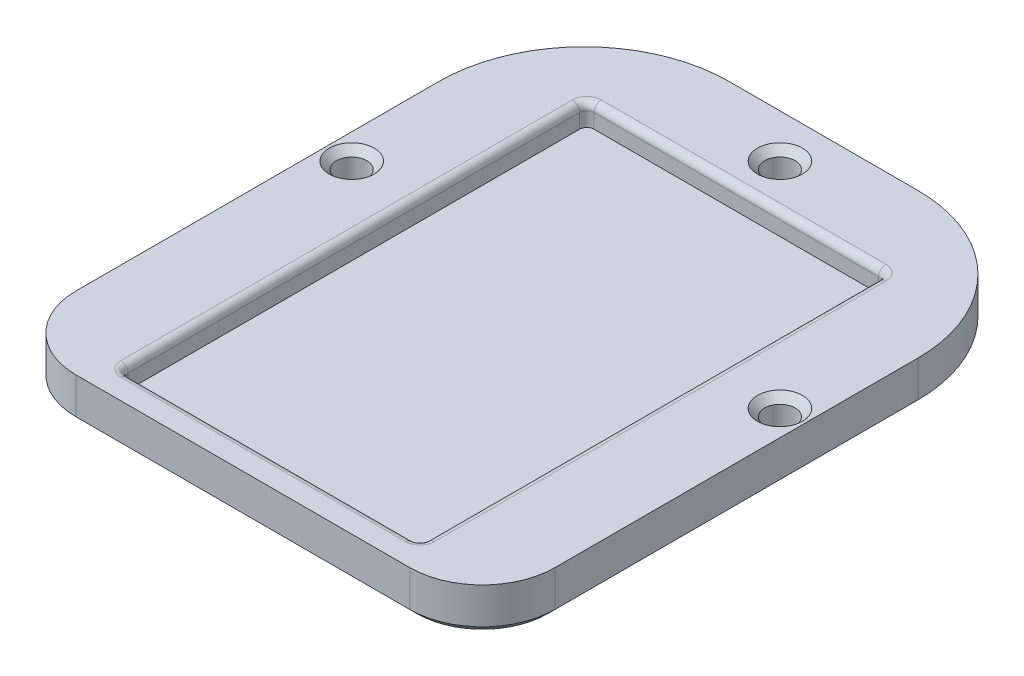
from build123d import *

# Parameters (mm, degrees)
SKETCH_1_W          = 66
SKETCH_1_H          = 80
EXTRUDE_1_DEPTH     = 6
SKETCH_2_W          = 41.2
SKETCH_2_H          = 64.2
CUT_EXTRUDE_1_DEPTH = 3
FILLET_1_R          = 1
SKETCH_3_R          = 2.1
CUT_EXTRUDE_2_DEPTH = 53.201532545
CHAMFER_1_SIZE      = 1
FILLET_2_R          = 20
FILLET_3_R          = 10
CHAMFER_2_SIZE      = 1


with BuildPart() as part:
    # Эскиз1 → Бобышка-Вытянуть1 (new body)
    with BuildSketch(Plane(origin=(0, 0, 0), x_dir=(1, 0, 0), z_dir=(0, 1, 0))):
        Rectangle(SKETCH_1_W, SKETCH_1_H)
    extrude(amount=EXTRUDE_1_DEPTH)

    # Эскиз2 → Вырез-Вытянуть1 (cut)
    with BuildSketch(Plane(origin=(0, 6, 0), x_dir=(1, 0, 0), z_dir=(0, 1, 0))):
        with Locations((0, -4.1)):
            Rectangle(SKETCH_2_W, SKETCH_2_H)
    extrude(amount=-CUT_EXTRUDE_1_DEPTH, mode=Mode.SUBTRACT)

    # Скругление1
    fillet_1_edges = [part.edges().sort_by_distance(p)[0] for p in [
        (20.6, 4.5, -28),
        (20.6, 4.5, 36.2),
        (-20.6, 4.5, 36.2),
        (-20.6, 4.5, -28),
        (20.6, 6, 4.1),
        (0, 6, -28),
        (-20.6, 6, 4.1),
        (0, 6, 36.2),
    ]]
    fillet(fillet_1_edges, radius=FILLET_1_R)

    # Эскиз3 → Вырез-Вытянуть2 (cut, through all)
    with BuildSketch(Plane(origin=(0, 6, 0), x_dir=(1, 0, 0), z_dir=(0, 1, 0))):
        with Locations(Location((0, 34, 0), (0, 0, 270))):
            Circle(SKETCH_3_R)
        with Locations(Location((-29.5, 4.5, 0), (0, 0, 270))):
            Circle(SKETCH_3_R)
        with Locations(Location((29.5, 4.5, 0), (0, 0, 270))):
            Circle(SKETCH_3_R)
    extrude(amount=-CUT_EXTRUDE_2_DEPTH, mode=Mode.SUBTRACT)

    # Фаска1
    chamfer_1_edges = [part.edges().sort_by_distance(p)[0] for p in [
        (0, 6, -36.1),
        (-29.5, 6, -6.6),
        (29.5, 6, -6.6),
    ]]
    chamfer(chamfer_1_edges, length=CHAMFER_1_SIZE)

    # Скругление2
    fillet_2_edges = [part.edges().sort_by_distance(p)[0] for p in [
        (-33, 3, -40),
        (33, 3, -40),
    ]]
    fillet(fillet_2_edges, radius=FILLET_2_R)

    # Скругление3
    fillet_3_edges = [part.edges().sort_by_distance(p)[0] for p in [
        (33, 3, 40),
        (-33, 3, 40),
    ]]
    fillet(fillet_3_edges, radius=FILLET_3_R)

    # Фаска2
    # the kernel refuses this chamfer: 1 mm, written as the material it takes off along each edge
    with BuildSketch(Plane(origin=(-23, 0, 30), x_dir=(-1, 0, 0), z_dir=(0, 0, -1))) as chamfer_2_piece_1:
        Polygon((10, CHAMFER_2_SIZE), (10 - CHAMFER_2_SIZE, 0), (10, 0), align=None)
    revolve(axis=Axis((-23, 0, 30), (0, 1, 0)), revolution_arc=90, mode=Mode.SUBTRACT)
    with BuildSketch(Plane(origin=(0, 0, -34), x_dir=(0, 0, 1), z_dir=(-1, 0, 0))) as chamfer_2_piece_2:
        Polygon((2.1 + CHAMFER_2_SIZE, 0), (2.1, CHAMFER_2_SIZE), (2.1, 0), align=None)
    revolve(axis=Axis((0, 0, -34), (0, 1, 0)), mode=Mode.SUBTRACT)
    with BuildSketch(Plane(origin=(-29.5, 0, -4.5), x_dir=(0, 0, 1), z_dir=(-1, 0, 0))) as chamfer_2_piece_3:
        Polygon((2.1 + CHAMFER_2_SIZE, 0), (2.1, CHAMFER_2_SIZE), (2.1, 0), align=None)
    revolve(axis=Axis((-29.5, 0, -4.5), (0, 1, 0)), mode=Mode.SUBTRACT)
    with BuildSketch(Plane(origin=(29.5, 0, -4.5), x_dir=(0, 0, 1), z_dir=(-1, 0, 0))) as chamfer_2_piece_4:
        Polygon((2.1 + CHAMFER_2_SIZE, 0), (2.1, CHAMFER_2_SIZE), (2.1, 0), align=None)
    revolve(axis=Axis((29.5, 0, -4.5), (0, 1, 0)), mode=Mode.SUBTRACT)
    with BuildSketch(Plane(origin=(-33, 0, -20), x_dir=(-0.02749587661058908, 0.9996219169112968, 0), z_dir=(0, 0, 1)), Plane(origin=(33, 0, 30), x_dir=(0.02749587661058908, 0.9996219169112968, 0), z_dir=(0, 0, -1))) as chamfer_2_piece_5:
        Polygon((CHAMFER_2_SIZE * 0.999621916911, -CHAMFER_2_SIZE * 0.0274958766106), (-CHAMFER_2_SIZE * 0.0274958766106, -CHAMFER_2_SIZE * 0.999621916911), (0, 0), align=None)
    extrude(amount=50, mode=Mode.SUBTRACT)
    with BuildSketch(Plane(origin=(13, 0, -40), x_dir=(0, 0.9996219169112968, -0.02749587661058908), z_dir=(-1, 0, 0))) as chamfer_2_piece_6:
        Polygon((CHAMFER_2_SIZE * 0.999621916911, -CHAMFER_2_SIZE * 0.0274958766106), (-CHAMFER_2_SIZE * 0.0274958766106, -CHAMFER_2_SIZE * 0.999621916911), (0, 0), align=None)
    extrude(amount=26, mode=Mode.SUBTRACT)
    with BuildSketch(Plane(origin=(13, 0, -20), x_dir=(1, 0, 0), z_dir=(0, 0, 1))) as chamfer_2_piece_7:
        Polygon((20, CHAMFER_2_SIZE), (20 - CHAMFER_2_SIZE, 0), (20, 0), align=None)
    revolve(axis=Axis((13, 0, -20), (0, 1, 0)), revolution_arc=90, mode=Mode.SUBTRACT)
    with BuildSketch(Plane(origin=(-13, 0, -20), x_dir=(-1, 0, 0), z_dir=(0, 0, 1))) as chamfer_2_piece_8:
        Polygon((20, -CHAMFER_2_SIZE), (20 - CHAMFER_2_SIZE, 0), (20, 0), align=None)
    revolve(axis=Axis((-13, 0, -20), (0, -1, 0)), revolution_arc=90, mode=Mode.SUBTRACT)
    with BuildSketch(Plane(origin=(-23, 0, 40), x_dir=(0, 0.9996219169112968, 0.02749587661058908), z_dir=(1, 0, 0))) as chamfer_2_piece_9:
        Polygon((CHAMFER_2_SIZE * 0.999621916911, -CHAMFER_2_SIZE * 0.0274958766106), (-CHAMFER_2_SIZE * 0.0274958766106, -CHAMFER_2_SIZE * 0.999621916911), (0, 0), align=None)
    extrude(amount=46, mode=Mode.SUBTRACT)
    with BuildSketch(Plane(origin=(23, 0, 30), x_dir=(0, 0, 1), z_dir=(-1, 0, 0))) as chamfer_2_piece_10:
        Polygon((10, CHAMFER_2_SIZE), (10 - CHAMFER_2_SIZE, 0), (10, 0), align=None)
    revolve(axis=Axis((23, 0, 30), (0, 1, 0)), revolution_arc=90, mode=Mode.SUBTRACT)


solid = part.part
